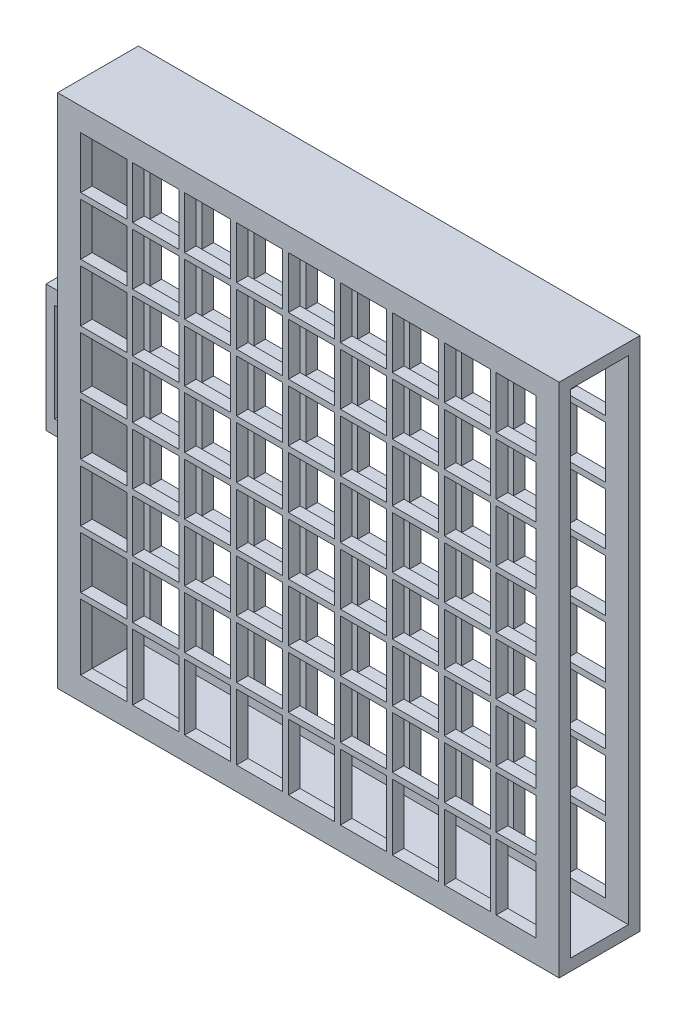
from build123d import *

# Parameters (mm, degrees)
EXTRUDE_1_DEPTH     = 14
SKETCH_1_7_W        = 84.9
SKETCH_1_7_H        = 85.4
SKETCH_1_7_W_2      = 78.9
SKETCH_1_7_H_2      = 81.4
EXTRUDE_3_DEPTH     = 2
SKETCH_1_9_W        = 8
SKETCH_1_9_H        = 9
EXTRUDE_4_DEPTH     = 2
SKETCH_1_10_W       = 8
SKETCH_1_10_H       = 9
EXTRUDE_5_DEPTH     = 2
SKETCH_2_W          = 84.9
SKETCH_2_H          = 85.4
SKETCH_2_W_2        = 78.9
SKETCH_2_H_2        = 81.4
EXTRUDE_7_DEPTH     = 2
SKETCH_2_6_W        = 8
SKETCH_2_6_H        = 9
EXTRUDE_8_DEPTH     = 2
SKETCH_2_7_W        = 8
SKETCH_2_7_H        = 9
EXTRUDE_9_DEPTH     = 2
SKETCH_3_W          = 6
SKETCH_3_H          = 22
EXTRUDE_10_DEPTH    = 6
SKETCH_4_W          = 3
SKETCH_4_H          = 17
CUT_EXTRUDE_1_DEPTH = 6
EXTRUDE_11_DEPTH    = 22


with BuildPart() as part:
    # 草图1 → 凸台-拉伸1 (new body)
    with BuildSketch(Plane.XY):
        Polygon((2, -87.4), (2, -2), (86.9, -2), (86.9, 0), (0, 0), (0, -89.4), (86.9, -89.4), (86.9, -87.4), align=None)
    extrude(amount=EXTRUDE_1_DEPTH)

    # 草图1<7> → 凸台-拉伸3 (add)
    with BuildSketch(Plane.XY):
        with Locations((44.45, -44.7)):
            Rectangle(SKETCH_1_7_W, SKETCH_1_7_H)
        with Locations((43.45, -44.7)):
            Rectangle(SKETCH_1_7_W_2, SKETCH_1_7_H_2, mode=Mode.SUBTRACT)
    extrude(amount=EXTRUDE_3_DEPTH)

    # 草图1<9> → 凸台-拉伸4 (add)
    with BuildSketch(Plane.XY):
        Polygon((22, -13), (22, -4), (21, -4), (21, -13), (13, -13), (13, -4), (12, -4), (12, -13), (4, -13), (4, -14), (57, -14), (57, -85.4), (58, -85.4), (58, -74), (66, -74), (66, -85.4), (67, -85.4), (67, -74), (75, -74), (75, -85.4), (76, -85.4), (76, -74), (82.9, -74), (82.9, -73), (76, -73), (76, -64), (82.9, -64), (82.9, -63), (76, -63), (76, -54), (82.9, -54), (82.9, -53), (76, -53), (76, -44), (82.9, -44), (82.9, -43), (76, -43), (76, -34), (82.9, -34), (82.9, -33), (76, -33), (76, -24), (82.9, -24), (82.9, -23), (76, -23), (76, -14), (82.9, -14), (82.9, -13), (76, -13), (76, -4), (75, -4), (75, -13), (67, -13), (67, -4), (66, -4), (66, -13), (58, -13), (58, -4), (57, -4), (57, -13), (49, -13), (49, -4), (48, -4), (48, -13), (40, -13), (40, -4), (39, -4), (39, -13), (31, -13), (31, -4), (30, -4), (30, -13), align=None)
        with Locations((62, -18.5)):
            Rectangle(SKETCH_1_9_W, SKETCH_1_9_H, mode=Mode.SUBTRACT)
        with Locations((71, -18.5)):
            Rectangle(SKETCH_1_9_W, SKETCH_1_9_H, mode=Mode.SUBTRACT)
        with Locations((62, -28.5)):
            Rectangle(SKETCH_1_9_W, SKETCH_1_9_H, mode=Mode.SUBTRACT)
        with Locations((71, -28.5)):
            Rectangle(SKETCH_1_9_W, SKETCH_1_9_H, mode=Mode.SUBTRACT)
        with Locations((62, -38.5)):
            Rectangle(SKETCH_1_9_W, SKETCH_1_9_H, mode=Mode.SUBTRACT)
        with Locations((71, -38.5)):
            Rectangle(SKETCH_1_9_W, SKETCH_1_9_H, mode=Mode.SUBTRACT)
        with Locations((62, -48.5)):
            Rectangle(SKETCH_1_9_W, SKETCH_1_9_H, mode=Mode.SUBTRACT)
        with Locations((71, -48.5)):
            Rectangle(SKETCH_1_9_W, SKETCH_1_9_H, mode=Mode.SUBTRACT)
        with Locations((62, -58.5)):
            Rectangle(SKETCH_1_9_W, SKETCH_1_9_H, mode=Mode.SUBTRACT)
        with Locations((71, -58.5)):
            Rectangle(SKETCH_1_9_W, SKETCH_1_9_H, mode=Mode.SUBTRACT)
        with Locations((62, -68.5)):
            Rectangle(SKETCH_1_9_W, SKETCH_1_9_H, mode=Mode.SUBTRACT)
        with Locations((71, -68.5)):
            Rectangle(SKETCH_1_9_W, SKETCH_1_9_H, mode=Mode.SUBTRACT)
    extrude(amount=EXTRUDE_4_DEPTH)

    # 草图1<10> → 凸台-拉伸5 (add)
    with BuildSketch(Plane.XY):
        Polygon((22, -23), (22, -14), (21, -14), (21, -23), (13, -23), (13, -14), (12, -14), (12, -23), (4, -23), (4, -24), (12, -24), (12, -33), (4, -33), (4, -34), (12, -34), (12, -43), (4, -43), (4, -44), (12, -44), (12, -53), (4, -53), (4, -54), (12, -54), (12, -63), (4, -63), (4, -64), (12, -64), (12, -73), (4, -73), (4, -74), (12, -74), (12, -85.4), (13, -85.4), (13, -74), (21, -74), (21, -85.4), (22, -85.4), (22, -74), (30, -74), (30, -85.4), (31, -85.4), (31, -74), (39, -74), (39, -85.4), (40, -85.4), (40, -74), (48, -74), (48, -85.4), (49, -85.4), (49, -74), (57, -74), (57, -73), (49, -73), (49, -64), (57, -64), (57, -63), (49, -63), (49, -54), (57, -54), (57, -53), (49, -53), (49, -44), (57, -44), (57, -43), (49, -43), (49, -34), (57, -34), (57, -33), (49, -33), (49, -24), (57, -24), (57, -23), (49, -23), (49, -14), (48, -14), (48, -23), (40, -23), (40, -14), (39, -14), (39, -23), (31, -23), (31, -14), (30, -14), (30, -23), align=None)
        with Locations((26, -28.5)):
            Rectangle(SKETCH_1_10_W, SKETCH_1_10_H, mode=Mode.SUBTRACT)
        with Locations((17, -28.5)):
            Rectangle(SKETCH_1_10_W, SKETCH_1_10_H, mode=Mode.SUBTRACT)
        with Locations((35, -28.5)):
            Rectangle(SKETCH_1_10_W, SKETCH_1_10_H, mode=Mode.SUBTRACT)
        with Locations((26, -38.5)):
            Rectangle(SKETCH_1_10_W, SKETCH_1_10_H, mode=Mode.SUBTRACT)
        with Locations((17, -38.5)):
            Rectangle(SKETCH_1_10_W, SKETCH_1_10_H, mode=Mode.SUBTRACT)
        with Locations((44, -28.5)):
            Rectangle(SKETCH_1_10_W, SKETCH_1_10_H, mode=Mode.SUBTRACT)
        with Locations((35, -38.5)):
            Rectangle(SKETCH_1_10_W, SKETCH_1_10_H, mode=Mode.SUBTRACT)
        with Locations((26, -48.5)):
            Rectangle(SKETCH_1_10_W, SKETCH_1_10_H, mode=Mode.SUBTRACT)
        with Locations((17, -48.5)):
            Rectangle(SKETCH_1_10_W, SKETCH_1_10_H, mode=Mode.SUBTRACT)
        with Locations((44, -38.5)):
            Rectangle(SKETCH_1_10_W, SKETCH_1_10_H, mode=Mode.SUBTRACT)
        with Locations((35, -48.5)):
            Rectangle(SKETCH_1_10_W, SKETCH_1_10_H, mode=Mode.SUBTRACT)
        with Locations((26, -58.5)):
            Rectangle(SKETCH_1_10_W, SKETCH_1_10_H, mode=Mode.SUBTRACT)
        with Locations((17, -58.5)):
            Rectangle(SKETCH_1_10_W, SKETCH_1_10_H, mode=Mode.SUBTRACT)
        with Locations((44, -48.5)):
            Rectangle(SKETCH_1_10_W, SKETCH_1_10_H, mode=Mode.SUBTRACT)
        with Locations((35, -58.5)):
            Rectangle(SKETCH_1_10_W, SKETCH_1_10_H, mode=Mode.SUBTRACT)
        with Locations((26, -68.5)):
            Rectangle(SKETCH_1_10_W, SKETCH_1_10_H, mode=Mode.SUBTRACT)
        with Locations((17, -68.5)):
            Rectangle(SKETCH_1_10_W, SKETCH_1_10_H, mode=Mode.SUBTRACT)
        with Locations((44, -58.5)):
            Rectangle(SKETCH_1_10_W, SKETCH_1_10_H, mode=Mode.SUBTRACT)
        with Locations((35, -68.5)):
            Rectangle(SKETCH_1_10_W, SKETCH_1_10_H, mode=Mode.SUBTRACT)
        with Locations((44, -68.5)):
            Rectangle(SKETCH_1_10_W, SKETCH_1_10_H, mode=Mode.SUBTRACT)
    extrude(amount=EXTRUDE_5_DEPTH)

    # 草图2 → 凸台-拉伸7 (add)
    with BuildSketch(Plane.XY.offset(14)):
        with Locations((44.45, -44.7)):
            Rectangle(SKETCH_2_W, SKETCH_2_H)
        with Locations((43.45, -44.7)):
            Rectangle(SKETCH_2_W_2, SKETCH_2_H_2, mode=Mode.SUBTRACT)
    extrude(amount=-EXTRUDE_7_DEPTH)

    # 草图2<6> → 凸台-拉伸8 (add)
    with BuildSketch(Plane.XY.offset(14)):
        Polygon((13, -4), (12, -4), (12, -13), (4, -13), (4, -14), (12, -14), (12, -23), (4, -23), (4, -24), (12, -24), (12, -33), (4, -33), (4, -34), (12, -34), (12, -43), (4, -43), (4, -44), (82.9, -44), (82.9, -43), (76, -43), (76, -34), (82.9, -34), (82.9, -33), (76, -33), (76, -24), (82.9, -24), (82.9, -23), (76, -23), (76, -14), (82.9, -14), (82.9, -13), (76, -13), (76, -4), (75, -4), (75, -13), (67, -13), (67, -4), (66, -4), (66, -13), (58, -13), (58, -4), (57, -4), (57, -13), (49, -13), (49, -4), (48, -4), (48, -13), (40, -13), (40, -4), (39, -4), (39, -13), (31, -13), (31, -4), (30, -4), (30, -13), (22, -13), (22, -4), (21, -4), (21, -13), (13, -13), align=None)
        with Locations((17, -18.5)):
            Rectangle(SKETCH_2_6_W, SKETCH_2_6_H, mode=Mode.SUBTRACT)
        with Locations((26, -18.5)):
            Rectangle(SKETCH_2_6_W, SKETCH_2_6_H, mode=Mode.SUBTRACT)
        with Locations((17, -28.5)):
            Rectangle(SKETCH_2_6_W, SKETCH_2_6_H, mode=Mode.SUBTRACT)
        with Locations((35, -18.5)):
            Rectangle(SKETCH_2_6_W, SKETCH_2_6_H, mode=Mode.SUBTRACT)
        with Locations((26, -28.5)):
            Rectangle(SKETCH_2_6_W, SKETCH_2_6_H, mode=Mode.SUBTRACT)
        with Locations((17, -38.5)):
            Rectangle(SKETCH_2_6_W, SKETCH_2_6_H, mode=Mode.SUBTRACT)
        with Locations((44, -18.5)):
            Rectangle(SKETCH_2_6_W, SKETCH_2_6_H, mode=Mode.SUBTRACT)
        with Locations((35, -28.5)):
            Rectangle(SKETCH_2_6_W, SKETCH_2_6_H, mode=Mode.SUBTRACT)
        with Locations((26, -38.5)):
            Rectangle(SKETCH_2_6_W, SKETCH_2_6_H, mode=Mode.SUBTRACT)
        with Locations((53, -18.5)):
            Rectangle(SKETCH_2_6_W, SKETCH_2_6_H, mode=Mode.SUBTRACT)
        with Locations((44, -28.5)):
            Rectangle(SKETCH_2_6_W, SKETCH_2_6_H, mode=Mode.SUBTRACT)
        with Locations((35, -38.5)):
            Rectangle(SKETCH_2_6_W, SKETCH_2_6_H, mode=Mode.SUBTRACT)
        with Locations((62, -18.5)):
            Rectangle(SKETCH_2_6_W, SKETCH_2_6_H, mode=Mode.SUBTRACT)
        with Locations((53, -28.5)):
            Rectangle(SKETCH_2_6_W, SKETCH_2_6_H, mode=Mode.SUBTRACT)
        with Locations((44, -38.5)):
            Rectangle(SKETCH_2_6_W, SKETCH_2_6_H, mode=Mode.SUBTRACT)
        with Locations((71, -18.5)):
            Rectangle(SKETCH_2_6_W, SKETCH_2_6_H, mode=Mode.SUBTRACT)
        with Locations((62, -28.5)):
            Rectangle(SKETCH_2_6_W, SKETCH_2_6_H, mode=Mode.SUBTRACT)
        with Locations((53, -38.5)):
            Rectangle(SKETCH_2_6_W, SKETCH_2_6_H, mode=Mode.SUBTRACT)
        with Locations((71, -28.5)):
            Rectangle(SKETCH_2_6_W, SKETCH_2_6_H, mode=Mode.SUBTRACT)
        with Locations((62, -38.5)):
            Rectangle(SKETCH_2_6_W, SKETCH_2_6_H, mode=Mode.SUBTRACT)
        with Locations((71, -38.5)):
            Rectangle(SKETCH_2_6_W, SKETCH_2_6_H, mode=Mode.SUBTRACT)
    extrude(amount=-EXTRUDE_8_DEPTH)

    # 草图2<7> → 凸台-拉伸9 (add)
    with BuildSketch(Plane.XY.offset(14)):
        Polygon((13, -44), (12, -44), (12, -53), (4, -53), (4, -54), (12, -54), (12, -63), (4, -63), (4, -64), (12, -64), (12, -73), (4, -73), (4, -74), (12, -74), (12, -85.4), (13, -85.4), (13, -74), (21, -74), (21, -85.4), (22, -85.4), (22, -74), (30, -74), (30, -85.4), (31, -85.4), (31, -74), (39, -74), (39, -85.4), (40, -85.4), (40, -74), (48, -74), (48, -85.4), (49, -85.4), (49, -74), (57, -74), (57, -85.4), (58, -85.4), (58, -74), (66, -74), (66, -85.4), (67, -85.4), (67, -74), (75, -74), (75, -85.4), (76, -85.4), (76, -74), (82.9, -74), (82.9, -73), (76, -73), (76, -64), (82.9, -64), (82.9, -63), (76, -63), (76, -54), (82.9, -54), (82.9, -53), (76, -53), (76, -44), (75, -44), (75, -53), (67, -53), (67, -44), (66, -44), (66, -53), (58, -53), (58, -44), (57, -44), (57, -53), (49, -53), (49, -44), (48, -44), (48, -53), (40, -53), (40, -44), (39, -44), (39, -53), (31, -53), (31, -44), (30, -44), (30, -53), (22, -53), (22, -44), (21, -44), (21, -53), (13, -53), align=None)
        with Locations((17, -58.5)):
            Rectangle(SKETCH_2_7_W, SKETCH_2_7_H, mode=Mode.SUBTRACT)
        with Locations((26, -58.5)):
            Rectangle(SKETCH_2_7_W, SKETCH_2_7_H, mode=Mode.SUBTRACT)
        with Locations((17, -68.5)):
            Rectangle(SKETCH_2_7_W, SKETCH_2_7_H, mode=Mode.SUBTRACT)
        with Locations((35, -58.5)):
            Rectangle(SKETCH_2_7_W, SKETCH_2_7_H, mode=Mode.SUBTRACT)
        with Locations((26, -68.5)):
            Rectangle(SKETCH_2_7_W, SKETCH_2_7_H, mode=Mode.SUBTRACT)
        with Locations((44, -58.5)):
            Rectangle(SKETCH_2_7_W, SKETCH_2_7_H, mode=Mode.SUBTRACT)
        with Locations((35, -68.5)):
            Rectangle(SKETCH_2_7_W, SKETCH_2_7_H, mode=Mode.SUBTRACT)
        with Locations((53, -58.5)):
            Rectangle(SKETCH_2_7_W, SKETCH_2_7_H, mode=Mode.SUBTRACT)
        with Locations((44, -68.5)):
            Rectangle(SKETCH_2_7_W, SKETCH_2_7_H, mode=Mode.SUBTRACT)
        with Locations((62, -58.5)):
            Rectangle(SKETCH_2_7_W, SKETCH_2_7_H, mode=Mode.SUBTRACT)
        with Locations((53, -68.5)):
            Rectangle(SKETCH_2_7_W, SKETCH_2_7_H, mode=Mode.SUBTRACT)
        with Locations((71, -58.5)):
            Rectangle(SKETCH_2_7_W, SKETCH_2_7_H, mode=Mode.SUBTRACT)
        with Locations((62, -68.5)):
            Rectangle(SKETCH_2_7_W, SKETCH_2_7_H, mode=Mode.SUBTRACT)
        with Locations((71, -68.5)):
            Rectangle(SKETCH_2_7_W, SKETCH_2_7_H, mode=Mode.SUBTRACT)
    extrude(amount=-EXTRUDE_9_DEPTH)

    # 草图3 → 凸台-拉伸10 (add)
    with BuildSketch(Plane.ZY):
        with Locations((7, -44.7)):
            Rectangle(SKETCH_3_W, SKETCH_3_H)
    extrude(amount=EXTRUDE_10_DEPTH)

    # 草图4 → 切除-拉伸1 (cut)
    with BuildSketch(Plane.XY.offset(10)):
        with Locations((-3, -44.7)):
            Rectangle(SKETCH_4_W, SKETCH_4_H)
    extrude(amount=-CUT_EXTRUDE_1_DEPTH, mode=Mode.SUBTRACT)

    # 草图6 → 凸台-拉伸11 (add)
    with BuildSketch(Plane.XZ.offset(55.7)):
        with BuildLine():
            add(Edge.make_bspline(
                [(0, 12.587058579), (-0.219338561, 10.999411439), (-1.5, 10)],
                knots=[0.447632084, 0.447632084, 0.447632084, 1.155180669, 1.155180669, 1.155180669], degree=2))
            Line((-1.5, 10), (0, 10))
            Line((0, 10), (0, 12.587058579))
        make_face()
    extrude(amount=-EXTRUDE_11_DEPTH)


solid = part.part
